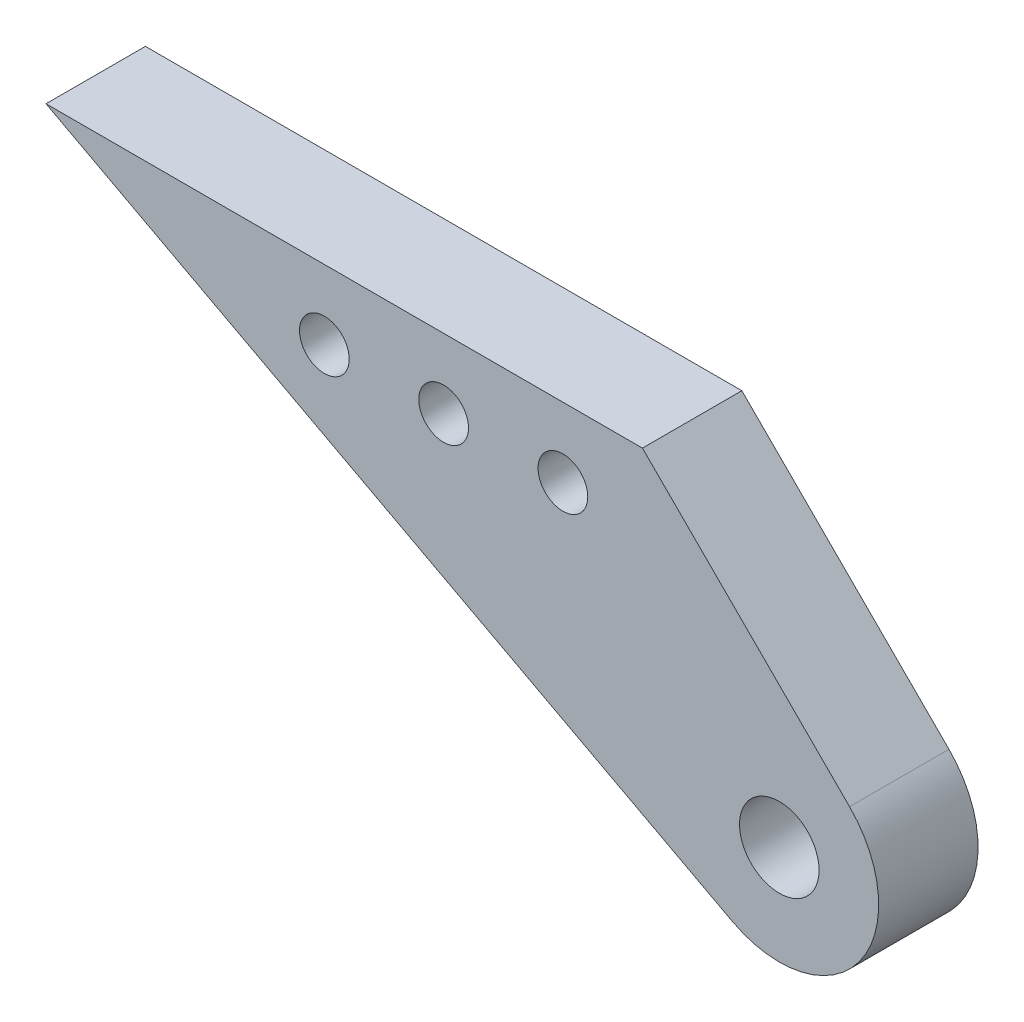
from build123d import *

# Parameters (mm, degrees)
SKETCH_2_R      = 1.25
SKETCH_2_R_2    = 2
EXTRUDE_1_DEPTH = 5


with BuildPart() as part:
    # 草图2 → 凸台-拉伸1 (new body)
    with BuildSketch(Plane.XY):
        with BuildLine():
            Line((-30, 0), (0, 0))
            Line((0, 0), (10.41786083, -10.411816738))
            ThreePointArc((10.41786083, -10.411816738), (10.903068725, -16.921907162), (4.535995155, -18.363114356))
            Line((4.535995155, -18.363114356), (-30, 0))
        make_face()
        with Locations((-4, -3.5)):
            Circle(SKETCH_2_R, mode=Mode.SUBTRACT)
        with Locations((6.883352969, -13.948376392)):
            Circle(SKETCH_2_R_2, mode=Mode.SUBTRACT)
        with Locations((-10, -3.5)):
            Circle(SKETCH_2_R, mode=Mode.SUBTRACT)
        with Locations((-16, -3.5)):
            Circle(SKETCH_2_R, mode=Mode.SUBTRACT)
    extrude(amount=EXTRUDE_1_DEPTH)


solid = part.part
